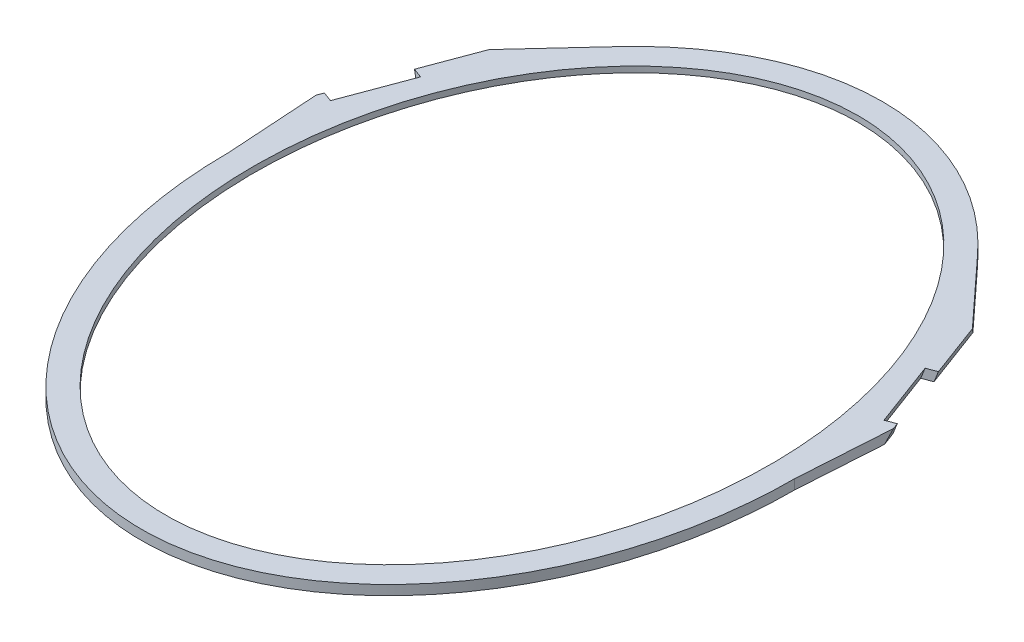
from build123d import *

# Parameters (mm, degrees)
SKETCH1_RX          = 380
SKETCH1_RY          = 290
SKETCH1_RX_2        = 355
SKETCH1_RY_2        = 265
BOSS_EXTRUDE1_DEPTH = 10
SKETCH2_RX          = 365
SKETCH2_RY          = 275
SKETCH2_RX_2        = 355
SKETCH2_RY_2        = 265
CUT_EXTRUDE1_DEPTH  = 4
BOSS_EXTRUDE2_DEPTH = 10
SKETCH5_W           = 309.529934858
SKETCH5_H           = 171.672064711
CUT_EXTRUDE2_DEPTH  = 733.191142452
CUT_EXTRUDE3_DEPTH  = 10


with BuildPart() as part:
    # Sketch1 → Boss-Extrude1 (new body)
    with BuildSketch(Plane(origin=(0, 0, 0), x_dir=(1, 0, 0), z_dir=(0, 1, 0))):
        with Locations(Location((0, 0), (0, 0, 90))):
            Ellipse(SKETCH1_RX, SKETCH1_RY)
        with Locations(Location((0, 0), (0, 0, 90))):
            Ellipse(SKETCH1_RX_2, SKETCH1_RY_2, mode=Mode.SUBTRACT)
    extrude(amount=BOSS_EXTRUDE1_DEPTH)

    # Sketch2 → Cut-Extrude1 (cut)
    with BuildSketch(Plane.XZ):
        with Locations(Location((0, 0), (0, 0, 90))):
            Ellipse(SKETCH2_RX, SKETCH2_RY)
        with Locations(Location((0, 0), (0, 0, 90))):
            Ellipse(SKETCH2_RX_2, SKETCH2_RY_2, mode=Mode.SUBTRACT)
    extrude(amount=-CUT_EXTRUDE1_DEPTH, mode=Mode.SUBTRACT)

    # Sketch4 → Boss-Extrude2 (add)
    with BuildSketch(Plane.XZ):
        Polygon((-290, 0), (-295.575664035, -86.619712155), (-300.752962755, -167.05069259), (-241.664357599, -231.114821492), (-235.398823472, -237.907941501), (-188.989530622, -288.225103524), (-243.259040828, -170.232954756), (-265.307990562, -122.294380272), align=None)
    boss_extrude2 = extrude(amount=-BOSS_EXTRUDE2_DEPTH)

    # Sketch5 → Cut-Extrude2 (cut, through all)
    with BuildSketch(Plane(origin=(-256.485650454, -95.695117721, -95.695117721), x_dir=(-0.3091654315444493, -0.11535001008591973, 0.9439868172337539), z_dir=(-0.8844332774281067, -0.3299831645537244, -0.3299831645537199))):
        with Locations((-84.653103238, 107.13606779)):
            Rectangle(SKETCH5_W, SKETCH5_H)
    cut_extrude2 = extrude(amount=CUT_EXTRUDE2_DEPTH, mode=Mode.SUBTRACT)

    # Sketch6 → Cut-Extrude3 (cut)
    with BuildSketch(Plane(origin=(-256.485650454, -95.695117721, -95.695117721), x_dir=(-0.30916543154444925, -0.11535001008591982, 0.9439868172337539), z_dir=(-0.8844332774281067, -0.3299831645537244, -0.32998316455371984))):
        Polygon((-4.788387249, 101.549240318), (-6.082838734, 112.063223708), (-7.163416958, 120.84005438), (-78.451876194, 112.063223708), (-77.371297971, 103.286393036), (-76.076846486, 92.772409646), (-74.782395001, 82.258426256), (-3.493935764, 91.035256928), align=None)
    cut_extrude3 = extrude(amount=-CUT_EXTRUDE3_DEPTH, mode=Mode.SUBTRACT)

    # Mirror1: Boss-Extrude2, Cut-Extrude2, Cut-Extrude3 across plane
    add(boss_extrude2.mirror(Plane(origin=(0, 0, 0), x_dir=(0, 0, 1), z_dir=(1, 0, 0))))
    add(cut_extrude2.mirror(Plane(origin=(0, 0, 0), x_dir=(0, 0, 1), z_dir=(1, 0, 0))), mode=Mode.SUBTRACT)
    add(cut_extrude3.mirror(Plane(origin=(0, 0, 0), x_dir=(0, 0, 1), z_dir=(1, 0, 0))), mode=Mode.SUBTRACT)


solid = part.part
